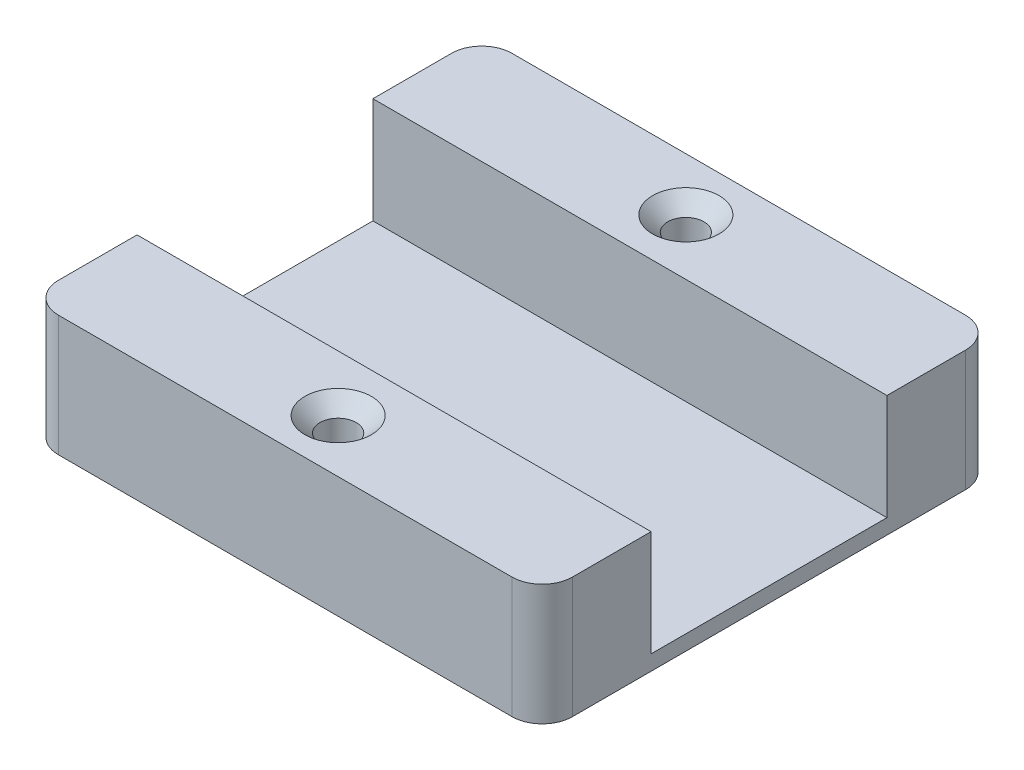
from build123d import *

# Parameters (mm, degrees)
BOSS_EXTRUDE1_DEPTH = 8
SKETCH2_W           = 7.8
SKETCH2_H           = 7
CUT_EXTRUDE1_DEPTH  = 25.04163056
CHAMFER1_SIZE       = 1
FILLET1_R           = 2


with BuildPart() as part:
    # Sketch1 → Boss-Extrude1 (new body)
    with BuildSketch(Plane(origin=(0, 0, 0), x_dir=(1, 0, 0), z_dir=(0, 1, 0))):
        with BuildLine():
            Line((17, 4.7), (17, 15))
            Line((17, 15), (0, 15))
            Line((0, 15), (0, 0))
            Line((0, 0), (17, 0))
            Line((17, 0), (17, 2.3))
            ThreePointArc((17, 2.3), (15.8, 3.5), (17, 4.7))
        make_face()
    extrude(amount=BOSS_EXTRUDE1_DEPTH)

    # Sketch2 → Cut-Extrude1 (cut, through all)
    with BuildSketch(Plane(origin=(17, 0, 0), x_dir=(0, 0, -1), z_dir=(1, 0, 0))):
        with Locations((11.1, 4.5)):
            Rectangle(SKETCH2_W, SKETCH2_H)
    extrude(amount=-CUT_EXTRUDE1_DEPTH, mode=Mode.SUBTRACT)

    # Chamfer1
    chamfer1_edges = [part.edges().sort_by_distance(p)[0] for p in [
        (15.8, 8, -3.5),
    ]]
    chamfer(chamfer1_edges, length=CHAMFER1_SIZE)

    # Mirror1: part across plane


with BuildPart() as part_1:
    add(part.part)
    add(part.part.mirror(Plane(origin=(17, 8, -4.7), x_dir=(0, 0, 1), z_dir=(-1, 0, 0))))

    # Mirror2: part across plane


with BuildPart() as part_2:
    add(part_1.part)
    add(part_1.part.mirror(Plane(origin=(0, 8, -15), x_dir=(1, 0, 0), z_dir=(0, 0, 1))))

    # Fillet1
    fillet1_edges = [part_2.edges().sort_by_distance(p)[0] for p in [
        (34, 4, -30),
        (0, 4, 0),
        (0, 4, -30),
        (34, 4, 0),
    ]]
    fillet(fillet1_edges, radius=FILLET1_R)


solid = part_2.part
